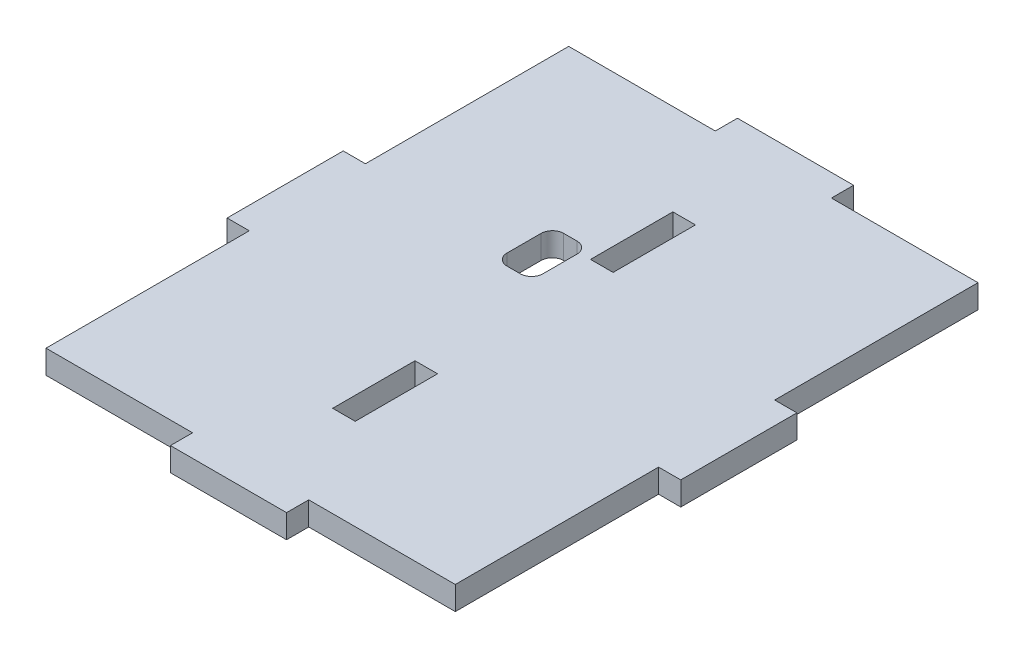
from build123d import *

# Parameters (mm, degrees)
SKETCH1_W           = 80
SKETCH1_H           = 100
BOSS_EXTRUDE1_DEPTH = 4.15
CUT_EXTRUDE5_DEPTH  = 10
SKETCH15_W          = 3.98
SKETCH15_H          = 14.52
CUT_EXTRUDE14_DEPTH = 10
SKETCH26_W          = 6.34
SKETCH26_H          = 10
CUT_EXTRUDE28_DEPTH = 10
FILLET1_R           = 2


with BuildPart() as part:
    # Sketch1 → Boss-Extrude1 (new body)
    with BuildSketch(Plane(origin=(0, 0, 0), x_dir=(1, 0, 0), z_dir=(0, 1, 0))):
        Rectangle(SKETCH1_W, SKETCH1_H)
    extrude(amount=BOSS_EXTRUDE1_DEPTH)

    # Sketch6 → Cut-Extrude5 (cut)
    with BuildSketch(Plane(origin=(0, 4.15, 0), x_dir=(1, 0, 0), z_dir=(0, 1, 0))):
        Polygon((-40, -50), (-10.24, -50), (-10.24, -46.09), (-36.09, -46.09), (-36.09, -10.24), (-40, -10.24), align=None)
        Polygon((10.24, -46.09), (10.24, -50), (40, -50), (40, -10.24), (36.09, -10.24), (36.09, -46.09), align=None)
        Polygon((-40, 10.24), (-36.09, 10.24), (-36.09, 46.09), (-10.24, 46.09), (-10.24, 50), (-40, 50), align=None)
        Polygon((36.09, 10.24), (40, 10.24), (40, 50), (10.24, 50), (10.24, 46.09), (36.09, 46.09), align=None)
    extrude(amount=-CUT_EXTRUDE5_DEPTH, mode=Mode.SUBTRACT)

    # Sketch15 → Cut-Extrude14 (cut)
    with BuildSketch(Plane(origin=(0, 4.15, 0), x_dir=(1, 0, 0), z_dir=(0, 1, 0))):
        with Locations((0.36, 22.74)):
            Rectangle(SKETCH15_W, SKETCH15_H)
        with Locations((0.36, -22.74)):
            Rectangle(SKETCH15_W, SKETCH15_H)
    extrude(amount=-CUT_EXTRUDE14_DEPTH, mode=Mode.SUBTRACT)

    # Sketch26 → Cut-Extrude28 (cut)
    with BuildSketch(Plane(origin=(0, 4.15, 0), x_dir=(1, 0, 0), z_dir=(0, 1, 0))):
        with Locations((-6.8, 12.09)):
            Rectangle(SKETCH26_W, SKETCH26_H)
    extrude(amount=-CUT_EXTRUDE28_DEPTH, mode=Mode.SUBTRACT)

    # Fillet1
    fillet1_edges = [part.edges().sort_by_distance(p)[0] for p in [
        (-9.97, 2.075, -17.09),
        (-3.63, 2.075, -17.09),
        (-9.97, 2.075, -7.09),
        (-3.63, 2.075, -7.09),
    ]]
    fillet(fillet1_edges, radius=FILLET1_R)


solid = part.part
